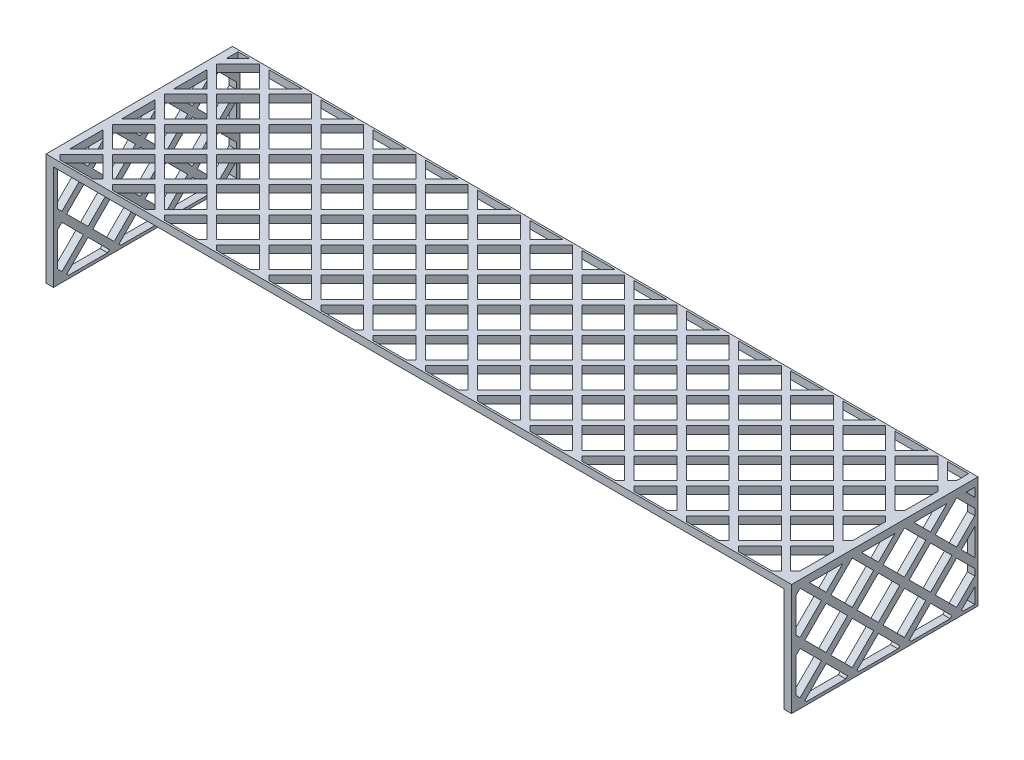
from build123d import *

# Parameters (mm, degrees)
SKETCH1_W           = 100
SKETCH1_H           = 25
BOSS_EXTRUDE1_DEPTH = 1
SKETCH2_W           = 1
SKETCH2_H           = 25
BOSS_EXTRUDE2_DEPTH = 14
CUT_EXTRUDE4_DEPTH  = 2
CUT_EXTRUDE11_DEPTH = 129


with BuildPart() as part:
    # Sketch1 → Boss-Extrude1 (new body)
    with BuildSketch(Plane(origin=(0, 0, 0), x_dir=(1, 0, 0), z_dir=(0, 1, 0))):
        with Locations((-20.98806366, 0)):
            Rectangle(SKETCH1_W, SKETCH1_H)
    extrude(amount=BOSS_EXTRUDE1_DEPTH)

    # Sketch2 → Boss-Extrude2 (add)
    with BuildSketch(Plane.XZ):
        with Locations((28.51193634, 0)):
            Rectangle(SKETCH2_W, SKETCH2_H)
        with Locations((-70.48806366, 0)):
            Rectangle(SKETCH2_W, SKETCH2_H)
    extrude(amount=BOSS_EXTRUDE2_DEPTH)

    # Sketch4 → Cut-Extrude4 (cut)
    with BuildSketch(Plane(origin=(0, 1, 0), x_dir=(1, 0, 0), z_dir=(0, 1, 0))):
        Polygon((-67.12399778, 12.25), (-69.98806366, 9.38593412), (-67.12399778, 6.52186824), (-64.2599319, 9.38593412), align=None)
        Polygon((-65.852129541, 12.25), (-61.39586602, 12.25), (-63.62399778, 10.02186824), align=None)
        Polygon((-69.352129541, -12.25), (-64.89586602, -12.25), (-64.2599319, -11.61406588), (-67.12399778, -8.75), (-69.98806366, -11.61406588), align=None)
        Polygon((-57.2599319, 9.38593412), (-60.12399778, 12.25), (-62.98806366, 9.38593412), (-60.12399778, 6.52186824), align=None)
        Polygon((-60.7599319, 5.88593412), (-63.62399778, 8.75), (-66.48806366, 5.88593412), (-63.62399778, 3.02186824), align=None)
        Polygon((-67.7599319, 5.88593412), (-69.98806366, 8.11406588), (-69.98806366, 3.65780236), align=None)
        Polygon((-64.2599319, 2.38593412), (-67.12399778, 5.25), (-69.98806366, 2.38593412), (-67.12399778, -0.47813176), align=None)
        Polygon((-64.2599319, -4.61406588), (-67.12399778, -1.75), (-69.98806366, -4.61406588), (-67.12399778, -7.47813176), align=None)
        Polygon((-67.7599319, -1.11406588), (-69.98806366, 1.11406588), (-69.98806366, -3.34219764), align=None)
        Polygon((-67.7599319, -8.11406588), (-69.98806366, -5.88593412), (-69.98806366, -10.34219764), align=None)
        Polygon((-69.98806366, 12.25), (-69.98806366, 10.65780236), (-68.39586602, 12.25), align=None)
        Polygon((-57.2599319, 2.38593412), (-60.12399778, 5.25), (-62.98806366, 2.38593412), (-60.12399778, -0.47813176), align=None)
        Polygon((-57.2599319, -4.61406588), (-60.12399778, -1.75), (-62.98806366, -4.61406588), (-60.12399778, -7.47813176), align=None)
        Polygon((-62.352129541, -12.25), (-57.89586602, -12.25), (-57.2599319, -11.61406588), (-60.12399778, -8.75), (-62.98806366, -11.61406588), align=None)
        Polygon((-50.2599319, 9.38593412), (-53.12399778, 12.25), (-55.98806366, 9.38593412), (-53.12399778, 6.52186824), align=None)
        Polygon((-50.2599319, 2.38593412), (-53.12399778, 5.25), (-55.98806366, 2.38593412), (-53.12399778, -0.47813176), align=None)
        Polygon((-50.2599319, -4.61406588), (-53.12399778, -1.75), (-55.98806366, -4.61406588), (-53.12399778, -7.47813176), align=None)
        Polygon((-55.352129541, -12.25), (-50.89586602, -12.25), (-50.2599319, -11.61406588), (-53.12399778, -8.75), (-55.98806366, -11.61406588), align=None)
        Polygon((-43.2599319, 9.38593412), (-46.12399778, 12.25), (-48.98806366, 9.38593412), (-46.12399778, 6.52186824), align=None)
        Polygon((-43.2599319, 2.38593412), (-46.12399778, 5.25), (-48.98806366, 2.38593412), (-46.12399778, -0.47813176), align=None)
        Polygon((-43.2599319, -4.61406588), (-46.12399778, -1.75), (-48.98806366, -4.61406588), (-46.12399778, -7.47813176), align=None)
        Polygon((-48.352129541, -12.25), (-43.89586602, -12.25), (-43.2599319, -11.61406588), (-46.12399778, -8.75), (-48.98806366, -11.61406588), align=None)
        Polygon((-36.2599319, 9.38593412), (-39.12399778, 12.25), (-41.98806366, 9.38593412), (-39.12399778, 6.52186824), align=None)
        Polygon((-36.2599319, 2.38593412), (-39.12399778, 5.25), (-41.98806366, 2.38593412), (-39.12399778, -0.47813176), align=None)
        Polygon((-36.2599319, -4.61406588), (-39.12399778, -1.75), (-41.98806366, -4.61406588), (-39.12399778, -7.47813176), align=None)
        Polygon((-41.352129541, -12.25), (-36.89586602, -12.25), (-36.2599319, -11.61406588), (-39.12399778, -8.75), (-41.98806366, -11.61406588), align=None)
        Polygon((-29.2599319, 9.38593412), (-32.12399778, 12.25), (-34.98806366, 9.38593412), (-32.12399778, 6.52186824), align=None)
        Polygon((-29.2599319, 2.38593412), (-32.12399778, 5.25), (-34.98806366, 2.38593412), (-32.12399778, -0.47813176), align=None)
        Polygon((-29.2599319, -4.61406588), (-32.12399778, -1.75), (-34.98806366, -4.61406588), (-32.12399778, -7.47813176), align=None)
        Polygon((-34.352129541, -12.25), (-29.89586602, -12.25), (-29.2599319, -11.61406588), (-32.12399778, -8.75), (-34.98806366, -11.61406588), align=None)
        Polygon((-22.2599319, 9.38593412), (-25.12399778, 12.25), (-27.98806366, 9.38593412), (-25.12399778, 6.52186824), align=None)
        Polygon((-22.2599319, 2.38593412), (-25.12399778, 5.25), (-27.98806366, 2.38593412), (-25.12399778, -0.47813176), align=None)
        Polygon((-22.2599319, -4.61406588), (-25.12399778, -1.75), (-27.98806366, -4.61406588), (-25.12399778, -7.47813176), align=None)
        Polygon((-27.352129541, -12.25), (-22.89586602, -12.25), (-22.2599319, -11.61406588), (-25.12399778, -8.75), (-27.98806366, -11.61406588), align=None)
        Polygon((-15.2599319, 9.38593412), (-18.12399778, 12.25), (-20.98806366, 9.38593412), (-18.12399778, 6.52186824), align=None)
        Polygon((-15.2599319, 2.38593412), (-18.12399778, 5.25), (-20.98806366, 2.38593412), (-18.12399778, -0.47813176), align=None)
        Polygon((-15.2599319, -4.61406588), (-18.12399778, -1.75), (-20.98806366, -4.61406588), (-18.12399778, -7.47813176), align=None)
        Polygon((-20.352129541, -12.25), (-15.89586602, -12.25), (-15.2599319, -11.61406588), (-18.12399778, -8.75), (-20.98806366, -11.61406588), align=None)
        Polygon((-8.2599319, 9.38593412), (-11.12399778, 12.25), (-13.98806366, 9.38593412), (-11.12399778, 6.52186824), align=None)
        Polygon((-8.2599319, 2.38593412), (-11.12399778, 5.25), (-13.98806366, 2.38593412), (-11.12399778, -0.47813176), align=None)
        Polygon((-8.2599319, -4.61406588), (-11.12399778, -1.75), (-13.98806366, -4.61406588), (-11.12399778, -7.47813176), align=None)
        Polygon((-13.352129541, -12.25), (-8.89586602, -12.25), (-8.2599319, -11.61406588), (-11.12399778, -8.75), (-13.98806366, -11.61406588), align=None)
        Polygon((-1.2599319, 9.38593412), (-4.12399778, 12.25), (-6.98806366, 9.38593412), (-4.12399778, 6.52186824), align=None)
        Polygon((-1.2599319, 2.38593412), (-4.12399778, 5.25), (-6.98806366, 2.38593412), (-4.12399778, -0.47813176), align=None)
        Polygon((-1.2599319, -4.61406588), (-4.12399778, -1.75), (-6.98806366, -4.61406588), (-4.12399778, -7.47813176), align=None)
        Polygon((-6.352129541, -12.25), (-1.89586602, -12.25), (-1.2599319, -11.61406588), (-4.12399778, -8.75), (-6.98806366, -11.61406588), align=None)
        Polygon((5.7400681, 9.38593412), (2.87600222, 12.25), (0.01193634, 9.38593412), (2.87600222, 6.52186824), align=None)
        Polygon((5.7400681, 2.38593412), (2.87600222, 5.25), (0.01193634, 2.38593412), (2.87600222, -0.47813176), align=None)
        Polygon((5.7400681, -4.61406588), (2.87600222, -1.75), (0.01193634, -4.61406588), (2.87600222, -7.47813176), align=None)
        Polygon((0.647870459, -12.25), (5.10413398, -12.25), (5.7400681, -11.61406588), (2.87600222, -8.75), (0.01193634, -11.61406588), align=None)
        Polygon((12.7400681, 9.38593412), (9.87600222, 12.25), (7.01193634, 9.38593412), (9.87600222, 6.52186824), align=None)
        Polygon((12.7400681, 2.38593412), (9.87600222, 5.25), (7.01193634, 2.38593412), (9.87600222, -0.47813176), align=None)
        Polygon((12.7400681, -4.61406588), (9.87600222, -1.75), (7.01193634, -4.61406588), (9.87600222, -7.47813176), align=None)
        Polygon((7.647870459, -12.25), (12.10413398, -12.25), (12.7400681, -11.61406588), (9.87600222, -8.75), (7.01193634, -11.61406588), align=None)
        Polygon((19.7400681, 9.38593412), (16.87600222, 12.25), (14.01193634, 9.38593412), (16.87600222, 6.52186824), align=None)
        Polygon((19.7400681, 2.38593412), (16.87600222, 5.25), (14.01193634, 2.38593412), (16.87600222, -0.47813176), align=None)
        Polygon((19.7400681, -4.61406588), (16.87600222, -1.75), (14.01193634, -4.61406588), (16.87600222, -7.47813176), align=None)
        Polygon((14.647870459, -12.25), (19.10413398, -12.25), (19.7400681, -11.61406588), (16.87600222, -8.75), (14.01193634, -11.61406588), align=None)
        Polygon((26.7400681, 9.38593412), (23.87600222, 12.25), (21.01193634, 9.38593412), (23.87600222, 6.52186824), align=None)
        Polygon((26.7400681, 2.38593412), (23.87600222, 5.25), (21.01193634, 2.38593412), (23.87600222, -0.47813176), align=None)
        Polygon((26.7400681, -4.61406588), (23.87600222, -1.75), (21.01193634, -4.61406588), (23.87600222, -7.47813176), align=None)
        Polygon((21.647870459, -12.25), (26.10413398, -12.25), (26.7400681, -11.61406588), (23.87600222, -8.75), (21.01193634, -11.61406588), align=None)
        Polygon((-60.7599319, -1.11406588), (-63.62399778, 1.75), (-66.48806366, -1.11406588), (-63.62399778, -3.97813176), align=None)
        Polygon((-60.7599319, -8.11406588), (-63.62399778, -5.25), (-66.48806366, -8.11406588), (-63.62399778, -10.97813176), align=None)
        Polygon((-58.852129541, 12.25), (-54.39586602, 12.25), (-56.62399778, 10.02186824), align=None)
        Polygon((-53.7599319, 5.88593412), (-56.62399778, 8.75), (-59.48806366, 5.88593412), (-56.62399778, 3.02186824), align=None)
        Polygon((-53.7599319, -1.11406588), (-56.62399778, 1.75), (-59.48806366, -1.11406588), (-56.62399778, -3.97813176), align=None)
        Polygon((-53.7599319, -8.11406588), (-56.62399778, -5.25), (-59.48806366, -8.11406588), (-56.62399778, -10.97813176), align=None)
        Polygon((-51.852129541, 12.25), (-47.39586602, 12.25), (-49.62399778, 10.02186824), align=None)
        Polygon((-46.7599319, 5.88593412), (-49.62399778, 8.75), (-52.48806366, 5.88593412), (-49.62399778, 3.02186824), align=None)
        Polygon((-46.7599319, -1.11406588), (-49.62399778, 1.75), (-52.48806366, -1.11406588), (-49.62399778, -3.97813176), align=None)
        Polygon((-46.7599319, -8.11406588), (-49.62399778, -5.25), (-52.48806366, -8.11406588), (-49.62399778, -10.97813176), align=None)
        Polygon((-44.852129541, 12.25), (-40.39586602, 12.25), (-42.62399778, 10.02186824), align=None)
        Polygon((-39.7599319, 5.88593412), (-42.62399778, 8.75), (-45.48806366, 5.88593412), (-42.62399778, 3.02186824), align=None)
        Polygon((-39.7599319, -1.11406588), (-42.62399778, 1.75), (-45.48806366, -1.11406588), (-42.62399778, -3.97813176), align=None)
        Polygon((-39.7599319, -8.11406588), (-42.62399778, -5.25), (-45.48806366, -8.11406588), (-42.62399778, -10.97813176), align=None)
        Polygon((-37.852129541, 12.25), (-33.39586602, 12.25), (-35.62399778, 10.02186824), align=None)
        Polygon((-32.7599319, 5.88593412), (-35.62399778, 8.75), (-38.48806366, 5.88593412), (-35.62399778, 3.02186824), align=None)
        Polygon((-32.7599319, -1.11406588), (-35.62399778, 1.75), (-38.48806366, -1.11406588), (-35.62399778, -3.97813176), align=None)
        Polygon((-32.7599319, -8.11406588), (-35.62399778, -5.25), (-38.48806366, -8.11406588), (-35.62399778, -10.97813176), align=None)
        Polygon((-30.852129541, 12.25), (-26.39586602, 12.25), (-28.62399778, 10.02186824), align=None)
        Polygon((-25.7599319, 5.88593412), (-28.62399778, 8.75), (-31.48806366, 5.88593412), (-28.62399778, 3.02186824), align=None)
        Polygon((-25.7599319, -1.11406588), (-28.62399778, 1.75), (-31.48806366, -1.11406588), (-28.62399778, -3.97813176), align=None)
        Polygon((-25.7599319, -8.11406588), (-28.62399778, -5.25), (-31.48806366, -8.11406588), (-28.62399778, -10.97813176), align=None)
        Polygon((-23.852129541, 12.25), (-19.39586602, 12.25), (-21.62399778, 10.02186824), align=None)
        Polygon((-18.7599319, 5.88593412), (-21.62399778, 8.75), (-24.48806366, 5.88593412), (-21.62399778, 3.02186824), align=None)
        Polygon((-18.7599319, -1.11406588), (-21.62399778, 1.75), (-24.48806366, -1.11406588), (-21.62399778, -3.97813176), align=None)
        Polygon((-18.7599319, -8.11406588), (-21.62399778, -5.25), (-24.48806366, -8.11406588), (-21.62399778, -10.97813176), align=None)
        Polygon((-16.852129541, 12.25), (-12.39586602, 12.25), (-14.62399778, 10.02186824), align=None)
        Polygon((-11.7599319, 5.88593412), (-14.62399778, 8.75), (-17.48806366, 5.88593412), (-14.62399778, 3.02186824), align=None)
        Polygon((-11.7599319, -1.11406588), (-14.62399778, 1.75), (-17.48806366, -1.11406588), (-14.62399778, -3.97813176), align=None)
        Polygon((-11.7599319, -8.11406588), (-14.62399778, -5.25), (-17.48806366, -8.11406588), (-14.62399778, -10.97813176), align=None)
        Polygon((-9.852129541, 12.25), (-5.39586602, 12.25), (-7.62399778, 10.02186824), align=None)
        Polygon((-4.7599319, 5.88593412), (-7.62399778, 8.75), (-10.48806366, 5.88593412), (-7.62399778, 3.02186824), align=None)
        Polygon((-4.7599319, -1.11406588), (-7.62399778, 1.75), (-10.48806366, -1.11406588), (-7.62399778, -3.97813176), align=None)
        Polygon((-4.7599319, -8.11406588), (-7.62399778, -5.25), (-10.48806366, -8.11406588), (-7.62399778, -10.97813176), align=None)
        Polygon((-2.852129541, 12.25), (1.60413398, 12.25), (-0.62399778, 10.02186824), align=None)
        Polygon((2.2400681, 5.88593412), (-0.62399778, 8.75), (-3.48806366, 5.88593412), (-0.62399778, 3.02186824), align=None)
        Polygon((2.2400681, -1.11406588), (-0.62399778, 1.75), (-3.48806366, -1.11406588), (-0.62399778, -3.97813176), align=None)
        Polygon((2.2400681, -8.11406588), (-0.62399778, -5.25), (-3.48806366, -8.11406588), (-0.62399778, -10.97813176), align=None)
        Polygon((4.147870459, 12.25), (8.60413398, 12.25), (6.37600222, 10.02186824), align=None)
        Polygon((9.2400681, 5.88593412), (6.37600222, 8.75), (3.51193634, 5.88593412), (6.37600222, 3.02186824), align=None)
        Polygon((9.2400681, -1.11406588), (6.37600222, 1.75), (3.51193634, -1.11406588), (6.37600222, -3.97813176), align=None)
        Polygon((9.2400681, -8.11406588), (6.37600222, -5.25), (3.51193634, -8.11406588), (6.37600222, -10.97813176), align=None)
        Polygon((11.147870459, 12.25), (15.60413398, 12.25), (13.37600222, 10.02186824), align=None)
        Polygon((16.2400681, 5.88593412), (13.37600222, 8.75), (10.51193634, 5.88593412), (13.37600222, 3.02186824), align=None)
        Polygon((16.2400681, -1.11406588), (13.37600222, 1.75), (10.51193634, -1.11406588), (13.37600222, -3.97813176), align=None)
        Polygon((16.2400681, -8.11406588), (13.37600222, -5.25), (10.51193634, -8.11406588), (13.37600222, -10.97813176), align=None)
        Polygon((18.147870459, 12.25), (22.60413398, 12.25), (20.37600222, 10.02186824), align=None)
        Polygon((23.2400681, 5.88593412), (20.37600222, 8.75), (17.51193634, 5.88593412), (20.37600222, 3.02186824), align=None)
        Polygon((23.2400681, -1.11406588), (20.37600222, 1.75), (17.51193634, -1.11406588), (20.37600222, -3.97813176), align=None)
        Polygon((23.2400681, -8.11406588), (20.37600222, -5.25), (17.51193634, -8.11406588), (20.37600222, -10.97813176), align=None)
        Polygon((25.147870459, 12.25), (28.01193634, 12.25), (28.01193634, 10.65780236), (27.37600222, 10.02186824), align=None)
        Polygon((28.01193634, 8.11406588), (27.37600222, 8.75), (24.51193634, 5.88593412), (27.37600222, 3.02186824), (28.01193634, 3.65780236), align=None)
        Polygon((28.01193634, 1.11406588), (27.37600222, 1.75), (24.51193634, -1.11406588), (27.37600222, -3.97813176), (28.01193634, -3.34219764), align=None)
        Polygon((28.01193634, -5.88593412), (27.37600222, -5.25), (24.51193634, -8.11406588), (27.37600222, -10.97813176), (28.01193634, -10.34219764), align=None)
    extrude(amount=-CUT_EXTRUDE4_DEPTH, mode=Mode.SUBTRACT)

    # Sketch5 → Cut-Extrude11 (cut)
    with BuildSketch(Plane.ZY.offset(70.98806366)):
        Polygon((-9.636378394, 0), (-12.067695114, -2.431857408), (-12.067695114, -3.296563317), (-9.636378394, -5.727880038), (-6.772756787, -2.864258432), align=None)
        Polygon((-2.636378394, -5.727880038), (0.227243213, -2.864258432), (-2.636378394, 0), (-5.5, -2.864258432), align=None)
        Polygon((4.363621606, -5.727880038), (7.227243213, -2.864258432), (4.363621606, 0), (1.5, -2.864258432), align=None)
        Polygon((11.93203294, -5.159468704), (11.93203294, -0.56853774), (11.363621606, 0), (8.5, -2.864258432), (11.363621606, -5.727880038), align=None)
        Polygon((-6.136378394, -9.227880038), (-3.272756787, -6.364258432), (-6.136378394, -3.5), (-9, -6.364258432), align=None)
        Polygon((-3.908498356, 0), (-8.364258432, 0), (-6.136378394, -2.227880038), align=None)
        Polygon((3.091501644, 0), (-1.364258432, 0), (0.863621606, -2.227880038), align=None)
        Polygon((-12.067695114, 0), (-12.067695114, -1.159196759), (-10.908498356, 0), align=None)
        Polygon((10.091501644, 0), (5.635741568, 0), (7.863621606, -2.227880038), align=None)
        Polygon((-12.067695114, -8.159196759), (-10.272756787, -6.364258432), (-12.067695114, -4.568920938), align=None)
        Polygon((0.863621606, -9.227880038), (3.727243213, -6.364258432), (0.863621606, -3.5), (-2, -6.364258432), align=None)
        Polygon((7.863621606, -9.227880038), (10.727243213, -6.364258432), (7.863621606, -3.5), (5, -6.364258432), align=None)
        Polygon((-9.636378394, -12.727880038), (-6.772756787, -9.864258432), (-9.636378394, -7), (-12.067695114, -9.431857408), (-12.067695114, -10.296563317), align=None)
        Polygon((-2.636378394, -12.727880038), (0.227243213, -9.864258432), (-2.636378394, -7), (-5.5, -9.864258432), align=None)
        Polygon((4.363621606, -12.727880038), (7.227243213, -9.864258432), (4.363621606, -7), (1.5, -9.864258432), align=None)
        Polygon((11.93203294, -12.159468704), (11.93203294, -7.56853774), (11.363621606, -7), (8.5, -9.864258432), (11.363621606, -12.727880038), align=None)
        Polygon((-10.512549776, -13.60405142), (-10.272756787, -13.364258432), (-12.067695114, -11.568920938), (-12.067695114, -13.60405142), align=None)
        Polygon((-3.512549776, -13.60405142), (-3.272756787, -13.364258432), (-6.136378394, -10.5), (-9, -13.364258432), (-8.760207011, -13.60405142), align=None)
        Polygon((3.487450224, -13.60405142), (3.727243213, -13.364258432), (0.863621606, -10.5), (-2, -13.364258432), (-1.760207011, -13.60405142), align=None)
        Polygon((10.487450224, -13.60405142), (10.727243213, -13.364258432), (7.863621606, -10.5), (5, -13.364258432), (5.239792989, -13.60405142), align=None)
    extrude(amount=-CUT_EXTRUDE11_DEPTH, mode=Mode.SUBTRACT)


solid = part.part
